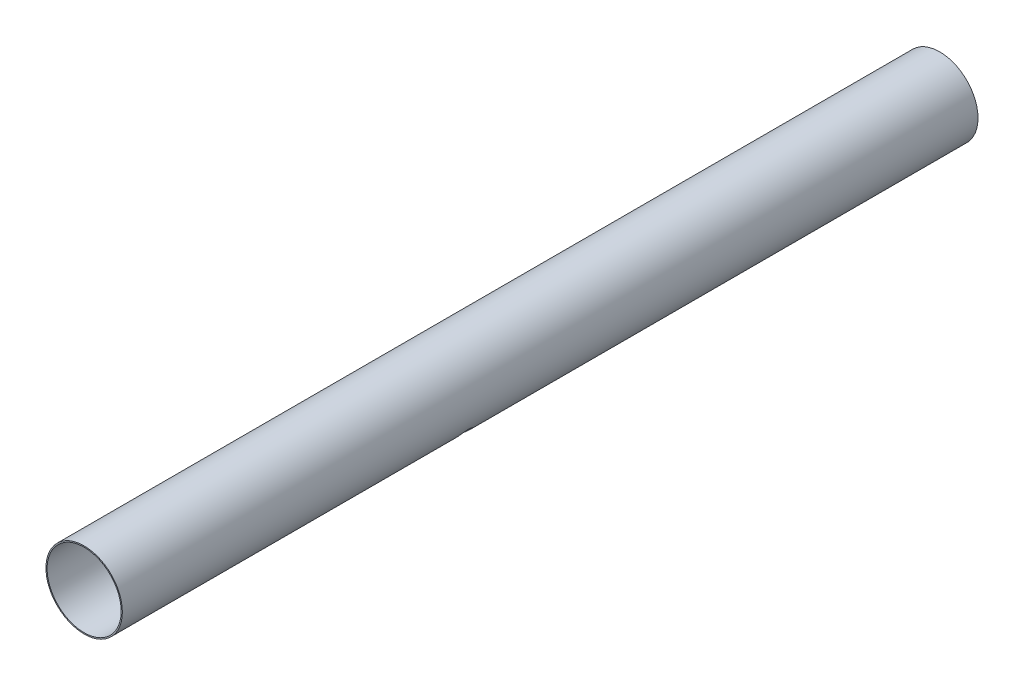
from build123d import *

# Parameters (mm, degrees)
SKETCH1_R           = 78.6
SKETCH1_R_2         = 76.2
BOSS_EXTRUDE1_DEPTH = 1760
SKETCH5_R           = 15
CUT_EXTRUDE2_DEPTH  = 1764.506711073


with BuildPart() as part:
    # Sketch1 → Boss-Extrude1 (new body)
    with BuildSketch(Plane.XY):
        Circle(SKETCH1_R)
        Circle(SKETCH1_R_2, mode=Mode.SUBTRACT)
    extrude(amount=BOSS_EXTRUDE1_DEPTH)

    # Sketch5 → Cut-Extrude2 (cut, through all)
    with BuildSketch(Plane(origin=(0, 0, 0), x_dir=(0, 0, -1), z_dir=(0.7071067811865489, -0.7071067811865462, 0))):
        with Locations((-1034.89, 0)):
            Circle(SKETCH5_R)
    extrude(amount=CUT_EXTRUDE2_DEPTH, mode=Mode.SUBTRACT)


solid = part.part
